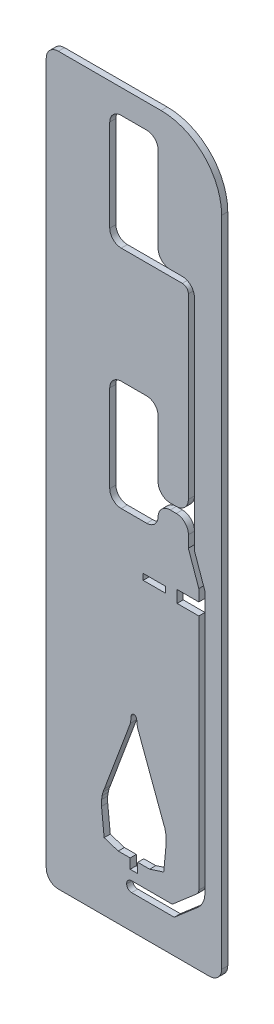
from build123d import *

# Parameters (mm, degrees)
BOSS_EXTRUDE4_DEPTH    = 1.016
CUT_EXTRUDE2_OUTLINE_W = 3.7
CUT_EXTRUDE2_OUTLINE_H = 1
CUT_EXTRUDE2_DEPTH     = 1.016


with BuildPart() as part:
    # Sketch6 → Boss-Extrude4 (new body)
    with BuildSketch(Plane.XY):
        with BuildLine():
            Line((-12.5, 60), (4.5, 60))
            ThreePointArc((4.5, 60), (11.571067812, 57.071067812), (14.5, 50))
            Line((14.5, 50), (14.5, -58))
            ThreePointArc((14.5, -58), (13.914213562, -59.414213562), (12.5, -60))
            Line((12.5, -60), (-12.5, -60))
            ThreePointArc((-12.5, -60), (-13.914213562, -59.414213562), (-14.5, -58))
            Line((-14.5, -58), (-14.5, 58))
            ThreePointArc((-14.5, 58), (-13.914213562, 59.414213562), (-12.5, 60))
        make_face()
    extrude(amount=BOSS_EXTRUDE4_DEPTH)

    # Cut-Extrude2: read off the stored shape, not the designer's step
    # Cut-Extrude2 outline → Cut-Extrude2 (cut)
    with BuildSketch(Plane.XY):
        with BuildLine():
            add(Edge.make_bspline(
                [(0.464136716, -29.280008599), (0.50069296, -29.588797386), (0.532256612, -29.958993284), (0.568812856, -30.267782071)],
                knots=[2, 2, 2, 2, 3, 3, 3, 3], degree=3))
            add(Edge.make_bspline(
                [(0.464136716, -29.280008599), (0.460815442, -29.004347325), (0.24608723, -28.738291079), (4.711e-06, -28.733078818)],
                knots=[25.000001953, 25.000001953, 25.000001953, 25.000001953, 25.984659899, 25.984659899, 25.984659899, 25.984659899], degree=3))
            add(Edge.make_bspline(
                [(-0.464136716, -29.280008613), (-0.460815442, -29.004347325), (-0.24608723, -28.738291079), (4.711e-06, -28.733078818)],
                knots=[25.000001953, 25.000001953, 25.000001953, 25.000001953, 25.984659899, 25.984659899, 25.984659899, 25.984659899], degree=3))
            Line((-0.464136716, -29.280008613), (-0.568812856, -30.267782071))
            Line((-0.568812856, -30.267782071), (-4.892180174, -41.831826427))
            Line((-4.892180174, -41.831826427), (-5.117963119, -42.406855927))
            Line((-5.117963119, -42.406855927), (-5.25555162, -43.003051232))
            Line((-5.25555162, -43.003051232), (-5.354849178, -43.616881121))
            Line((-5.354849178, -43.616881121), (-5.355849178, -44.579979095))
            Line((-5.355849178, -44.579979095), (-4.925, -48.85))
            Line((-4.925, -48.85), (-2.6, -49.6))
            Line((-2.6, -49.6), (-0.625, -49.6))
            Line((-0.625, -49.6), (-0.625, -51.23))
            Line((-0.625, -51.23), (0.625, -51.23))
            Line((0.625, -51.23), (0.625, -49.6))
            Line((0.625, -49.6), (2.6, -49.6))
            Line((2.6, -49.6), (4.925, -48.85))
            Line((4.925, -48.85), (5.332817408, -44.579979095))
            Line((5.332817408, -44.579979095), (5.328817408, -43.616881121))
            Line((5.328817408, -43.616881121), (5.232524742, -43.003051232))
            Line((5.232524742, -43.003051232), (5.094957773, -42.406855927))
            Line((5.094957773, -42.406855927), (4.862112382, -41.831826427))
            Line((4.862112382, -41.831826427), (0.568812856, -30.267782071))
        make_face()
        with BuildLine():
            ThreePointArc((4, 16.031829774), (3.443502884, 17.375332658), (2.1, 17.931829774))
            Line((2.1, 17.931829774), (-2.1, 17.931829774))
            ThreePointArc((-2.1, 17.931829774), (-3.443502884, 17.375332658), (-4, 16.031829774))
            Line((-4, 16.031829774), (-4, 1.6))
            ThreePointArc((-4, 1.6), (-3.443502884, 0.256497116), (-2.1, -0.3))
            Line((-2.1, -0.3), (2.1, -0.3))
            ThreePointArc((2.1, -0.3), (3.443502884, 0.256497116), (4, 1.6))
            ThreePointArc((4, 1.6), (4.602950898, 2.981782106), (5.999374902, 3.55))
            Line((5.999374902, 3.55), (7.000625098, 3.55))
            ThreePointArc((7.000625098, 3.55), (8.432407204, 2.946424004), (9, 1.5))
            Line((9, 1.5), (9, -0.435932815))
            Line((9, -0.435932815), (10.73, -5.355496174))
            Line((10.73, -5.355496174), (10.73, -7.27))
            Line((10.73, -7.27), (7.140268475, -7.27))
            Line((7.140268475, -7.27), (7.140268475, -9.27))
            Line((7.140268475, -9.27), (10.73, -9.27))
            Line((10.73, -9.27), (10.73, -48.528487843))
            ThreePointArc((10.73, -48.528487843), (10.644281066, -48.921574831), (10.402688829, -49.243286359))
            Line((10.402688829, -49.243286359), (6.339155629, -52.75))
            Line((6.339155629, -52.75), (-0.390660403, -52.75))
            ThreePointArc((-0.390660403, -52.75), (-0.96294992, -52.98705008), (-1.2, -53.559339597))
            Line((-1.2, -53.559339597), (-1.2, -53.640660403))
            ThreePointArc((-1.2, -53.640660403), (-0.96294992, -54.21294992), (-0.390660403, -54.45))
            Line((-0.390660403, -54.45), (6.665142853, -54.45))
            Line((6.665142853, -54.45), (10.556020375, -51.092283301))
            ThreePointArc((10.556020375, -51.092283301), (11.422548586, -49.938388133), (11.73, -48.528487843))
            Line((11.73, -48.528487843), (11.73, -5.184791238))
            Line((11.73, -5.184791238), (10, -0.265227879))
            Line((10, -0.265227879), (10, 36))
            ThreePointArc((10, 36), (9.414213562, 37.414213562), (8, 38))
            Line((8, 38), (6, 38))
            ThreePointArc((6, 38), (4.585786438, 38.585786438), (4, 40))
            Line((4, 40), (4, 54.1))
            ThreePointArc((4, 54.1), (3.443502884, 55.443502884), (2.1, 56))
            Line((2.1, 56), (-2.1, 56))
            ThreePointArc((-2.1, 56), (-3.443502884, 55.443502884), (-4, 54.1))
            Line((-4, 54.1), (-4, 38.9))
            ThreePointArc((-4, 38.9), (-3.443502884, 37.556497116), (-2.1, 37))
            Line((-2.1, 37), (8, 37))
            ThreePointArc((8, 37), (8.707106781, 36.707106781), (9, 36))
            Line((9, 36), (9, 6.55))
            ThreePointArc((9, 6.55), (8.414213562, 5.135786438), (7, 4.55))
            Line((7, 4.55), (6, 4.55))
            ThreePointArc((6, 4.55), (4.585786438, 5.135786438), (4, 6.55))
            Line((4, 6.55), (4, 16.031829774))
        make_face()
        with Locations((3.375465258, -8.27)):
            Rectangle(CUT_EXTRUDE2_OUTLINE_W, CUT_EXTRUDE2_OUTLINE_H)
    extrude(amount=CUT_EXTRUDE2_DEPTH, mode=Mode.SUBTRACT)


solid = part.part
